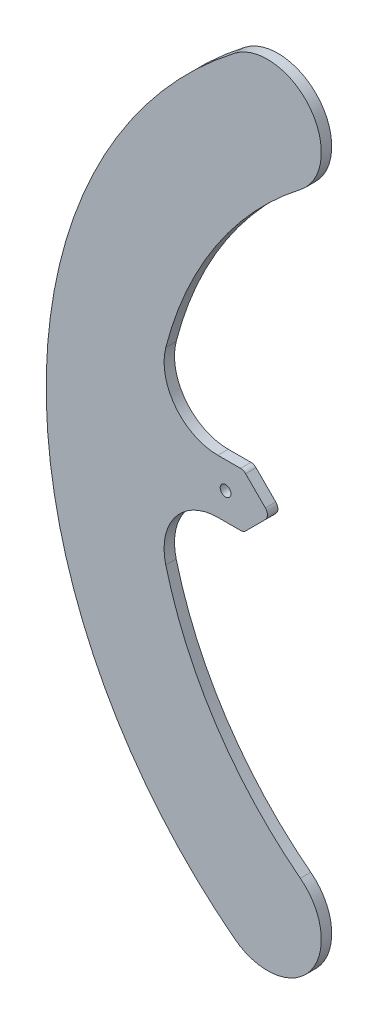
from build123d import *

# Parameters (mm, degrees)
SKETCH1_R           = 1.5
BOSS_EXTRUDE1_DEPTH = 2.9
FILLET1_R           = 15
FILLET2_R           = 2


with BuildPart() as part:
    # Sketch1 → Boss-Extrude1 (new body)
    with BuildSketch(Plane.XY):
        with BuildLine():
            ThreePointArc((-11.978690202, -106.875000176), (9.060608576, -104.164298847), (6.349907492, -83.125000037))
            ThreePointArc((6.349907492, -83.125000037), (-22.020584681, -49.648176304), (-34.231800328, -7.5))
            Line((-34.231800328, -7.5), (-9.5, -7.5))
            Line((-9.5, -7.5), (-2, 0))
            Line((-2, 0), (-9.5, 7.5))
            Line((-9.5, 7.5), (-34.231800328, 7.5))
            ThreePointArc((-34.231800328, 7.5), (-22.020584787, 49.648176107), (6.349907137, 83.124999763))
            ThreePointArc((6.349907137, 83.124999763), (9.060608638, 104.164298767), (-11.978690398, 106.875000025))
            ThreePointArc((-11.978690398, 106.875000025), (-64.5, -1.24e-07), (-11.978690202, -106.875000176))
        make_face()
        with Locations((-14.5, 0)):
            Circle(SKETCH1_R, mode=Mode.SUBTRACT)
    extrude(amount=BOSS_EXTRUDE1_DEPTH)

    # Fillet1
    fillet1_edges = [part.edges().sort_by_distance(p)[0] for p in [
        (-34.231800328, -7.5, 1.45),
        (-34.231800328, 7.5, 1.45),
    ]]
    fillet(fillet1_edges, radius=FILLET1_R)

    # Fillet2
    fillet2_edges = [part.edges().sort_by_distance(p)[0] for p in [
        (-9.5, -7.5, 1.45),
        (-9.5, 7.5, 1.45),
        (-2, 0, 1.45),
    ]]
    fillet(fillet2_edges, radius=FILLET2_R)


solid = part.part
